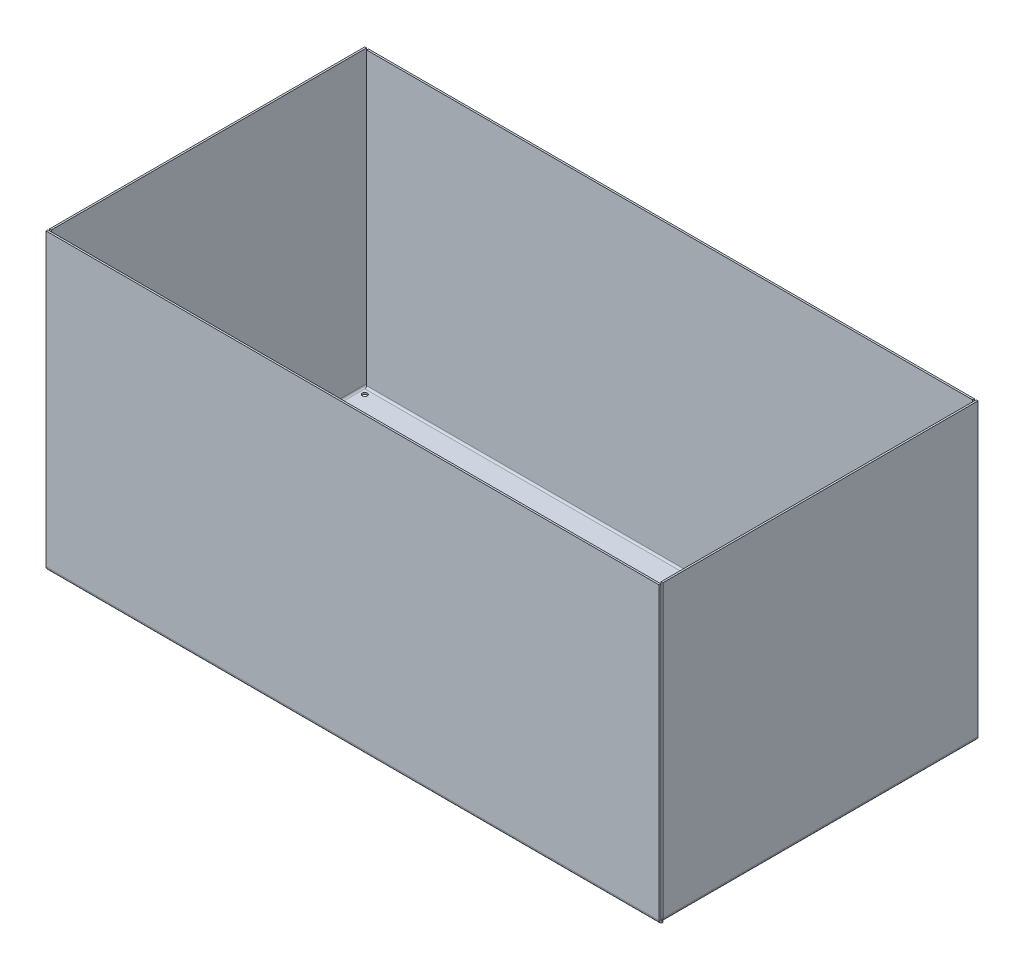
from build123d import *

# Parameters (mm, degrees)
SKETCH1_W                    = 250
SKETCH1_H                    = 130
BASE_FLANGE1_DEPTH           = 0.7366
F_6_0_6_DIAMETER_HOLE1_D     = 6
EDGE_FLANGE1_STRIP_W         = 4.4196
EDGE_FLANGE1_STRIP_H         = 0.7366
EDGE_FLANGE1_STRIP_CUT_DEPTH = 250
EDGE_FLANGE1_DEPTH           = 250
EDGE_FLANGE2_STRIP_W         = 4.4196
EDGE_FLANGE2_STRIP_H         = 0.7366
EDGE_FLANGE2_STRIP_CUT_DEPTH = 128.5268
EDGE_FLANGE2_DEPTH           = 128.5268
EDGE_FLANGE3_STRIP_W         = 4.4196
EDGE_FLANGE3_STRIP_H         = 0.7366
EDGE_FLANGE3_STRIP_CUT_DEPTH = 128.5268
EDGE_FLANGE3_DEPTH           = 128.5268
EDGE_FLANGE4_STRIP_W         = 4.4196
EDGE_FLANGE4_STRIP_H         = 0.7366
EDGE_FLANGE4_STRIP_CUT_DEPTH = 247.0536
EDGE_FLANGE4_DEPTH           = 247.0536
F_2_0_2_DIAMETER_HOLE2_D     = 2
F_2_0_2_DIAMETER_HOLE3_D     = 2


# Sheet-metal steps are written as plain solids
with BuildPart() as part:
    # Sketch1 → Base-Flange1 (new body)
    with BuildSketch(Plane(origin=(0, 0, 0), x_dir=(1, 0, 0), z_dir=(0, 1, 0))):
        Rectangle(SKETCH1_W, SKETCH1_H)
    extrude(amount=-BASE_FLANGE1_DEPTH)

    # Ø6.0 (6) Diameter Hole1 (through all)
    with Locations(Plane(origin=(0, 0, 0), x_dir=(1, 0, 0), z_dir=(0, 1, 0))):
        with Locations((0, 0)):
            Hole(F_6_0_6_DIAMETER_HOLE1_D / 2)

    # Edge-Flange1 strip (across the edge) → Edge-Flange1 strip cut (cut)
    with BuildSketch(Plane(origin=(-125, 0, 65), x_dir=(0, 0, -1), z_dir=(1, 0, 0))):
        with Locations((-0.7366, -0.3683)):
            Rectangle(EDGE_FLANGE1_STRIP_W, EDGE_FLANGE1_STRIP_H)
    extrude(amount=EDGE_FLANGE1_STRIP_CUT_DEPTH, mode=Mode.SUBTRACT)

    # Edge-Flange1 section (across the edge) → Edge-Flange1 (add)
    with BuildSketch(Plane(origin=(-125, 0, 65), x_dir=(0, 0, -1), z_dir=(1, 0, 0))):
        with BuildLine():
            Line((0, 0.7366), (0, 119.2634))
            Line((0, 119.2634), (0.7366, 119.2634))
            Line((0.7366, 119.2634), (0.7366, 0.7366))
            ThreePointArc((0.7366, 0.7366), (0.952345145, 0.215745145), (1.4732, 0))
            Line((1.4732, 0), (1.4732, -0.7366))
            ThreePointArc((1.4732, -0.7366), (0.43149029, -0.30510971), (0, 0.7366))
        make_face()
    extrude(amount=EDGE_FLANGE1_DEPTH)

    # Edge-Flange2 strip (across the edge) → Edge-Flange2 strip cut (cut)
    with BuildSketch(Plane(origin=(125, 0, 63.5268), x_dir=(-1, 0, 0), z_dir=(0, 0, -1))):
        with Locations((-0.7366, -0.3683)):
            Rectangle(EDGE_FLANGE2_STRIP_W, EDGE_FLANGE2_STRIP_H)
    extrude(amount=EDGE_FLANGE2_STRIP_CUT_DEPTH, mode=Mode.SUBTRACT)

    # Edge-Flange2 section (across the edge) → Edge-Flange2 (add)
    with BuildSketch(Plane(origin=(125, 0, 63.5268), x_dir=(-1, 0, 0), z_dir=(0, 0, -1))):
        with BuildLine():
            Line((0, 0.7366), (0, 119.2634))
            Line((0, 119.2634), (0.7366, 119.2634))
            Line((0.7366, 119.2634), (0.7366, 0.7366))
            ThreePointArc((0.7366, 0.7366), (0.952345145, 0.215745145), (1.4732, 0))
            Line((1.4732, 0), (1.4732, -0.7366))
            ThreePointArc((1.4732, -0.7366), (0.43149029, -0.30510971), (0, 0.7366))
        make_face()
    extrude(amount=EDGE_FLANGE2_DEPTH)

    # Edge-Flange3 strip (across the edge) → Edge-Flange3 strip cut (cut)
    with BuildSketch(Plane(origin=(-125, 0, -65), x_dir=(1, 0, 0), z_dir=(0, 0, 1))):
        with Locations((-0.7366, -0.3683)):
            Rectangle(EDGE_FLANGE3_STRIP_W, EDGE_FLANGE3_STRIP_H)
    extrude(amount=EDGE_FLANGE3_STRIP_CUT_DEPTH, mode=Mode.SUBTRACT)

    # Edge-Flange3 section (across the edge) → Edge-Flange3 (add)
    with BuildSketch(Plane(origin=(-125, 0, -65), x_dir=(1, 0, 0), z_dir=(0, 0, 1))):
        with BuildLine():
            Line((0, 0.7366), (0, 119.2634))
            Line((0, 119.2634), (0.7366, 119.2634))
            Line((0.7366, 119.2634), (0.7366, 0.7366))
            ThreePointArc((0.7366, 0.7366), (0.952345145, 0.215745145), (1.4732, 0))
            Line((1.4732, 0), (1.4732, -0.7366))
            ThreePointArc((1.4732, -0.7366), (0.43149029, -0.30510971), (0, 0.7366))
        make_face()
    extrude(amount=EDGE_FLANGE3_DEPTH)

    # Edge-Flange4 strip (across the edge) → Edge-Flange4 strip cut (cut)
    with BuildSketch(Plane(origin=(123.5268, 0, -65), x_dir=(0, 0, 1), z_dir=(-1, 0, 0))):
        with Locations((-0.7366, -0.3683)):
            Rectangle(EDGE_FLANGE4_STRIP_W, EDGE_FLANGE4_STRIP_H)
    extrude(amount=EDGE_FLANGE4_STRIP_CUT_DEPTH, mode=Mode.SUBTRACT)

    # Edge-Flange4 section (across the edge) → Edge-Flange4 (add)
    with BuildSketch(Plane(origin=(123.5268, 0, -65), x_dir=(0, 0, 1), z_dir=(-1, 0, 0))):
        with BuildLine():
            Line((0, 0.7366), (0, 119.2634))
            Line((0, 119.2634), (0.7366, 119.2634))
            Line((0.7366, 119.2634), (0.7366, 0.7366))
            ThreePointArc((0.7366, 0.7366), (0.952345145, 0.215745145), (1.4732, 0))
            Line((1.4732, 0), (1.4732, -0.7366))
            ThreePointArc((1.4732, -0.7366), (0.43149029, -0.30510971), (0, 0.7366))
        make_face()
    extrude(amount=EDGE_FLANGE4_DEPTH)

    # Ø2.0 (2) Diameter Hole2 (through all)
    with Locations(Plane(origin=(0, 0, 0), x_dir=(1, 0, 0), z_dir=(0, 1, 0))):
        with Locations((-121.5268, 61.5268)):
            Hole(F_2_0_2_DIAMETER_HOLE2_D / 2)

    # Ø2.0 (2) Diameter Hole3 (through all)
    with Locations(Plane(origin=(0, 0, 0), x_dir=(1, 0, 0), z_dir=(0, 1, 0))):
        with Locations((-121.5268, -61.5268), (121.5268, 61.5268), (121.5268, -61.5268)):
            Hole(F_2_0_2_DIAMETER_HOLE3_D / 2)


solid = part.part
